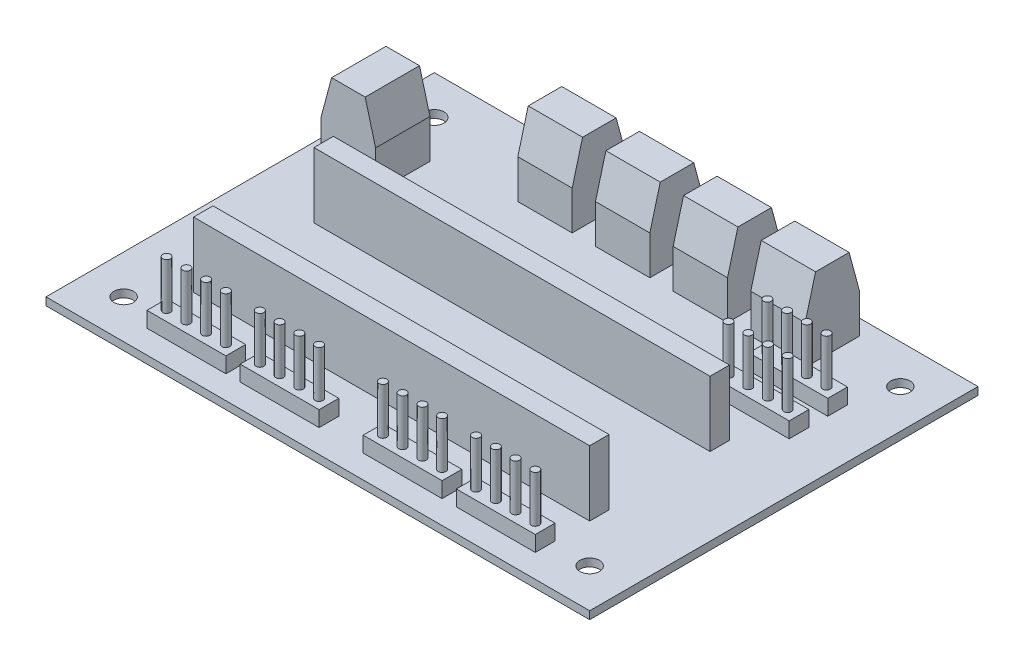
from build123d import *
from OCP.BRepFilletAPI import BRepFilletAPI_MakeChamfer

# Parameters (mm, degrees)
SKETCH_2_W      = 70
SKETCH_2_H      = 50
SKETCH_2_R      = 1.25
EXTRUDE_1_DEPTH = 1
SKETCH_3_W      = 51
SKETCH_3_H      = 2.5
EXTRUDE_2_DEPTH = 8.4
SKETCH_4_W      = 10.16
SKETCH_4_H      = 2.54
EXTRUDE_3_DEPTH = 2
SKETCH_5_R      = 0.5
EXTRUDE_4_DEPTH = 6
SKETCH_6_W      = 7
SKETCH_6_H      = 7
EXTRUDE_5_DEPTH = 10
CHAMFER_1_SIZE  = 5
CHAMFER_1_SIZE2 = 1.339745962


with BuildPart() as part:
    # Эскиз2 → Бобышка-Вытянуть1 (new body)
    with BuildSketch(Plane(origin=(0, 0, 0), x_dir=(1, 0, 0), z_dir=(0, 1, 0))):
        with Locations((35, 25)):
            Rectangle(SKETCH_2_W, SKETCH_2_H)
        with Locations((5, 45)):
            Circle(SKETCH_2_R, mode=Mode.SUBTRACT)
        with Locations((65, 45)):
            Circle(SKETCH_2_R, mode=Mode.SUBTRACT)
        with Locations((65, 5)):
            Circle(SKETCH_2_R, mode=Mode.SUBTRACT)
        with Locations((5, 5)):
            Circle(SKETCH_2_R, mode=Mode.SUBTRACT)
    extrude(amount=EXTRUDE_1_DEPTH)

    # Эскиз3 → Бобышка-Вытянуть2 (add)
    with BuildSketch(Plane(origin=(0, 1, 0), x_dir=(1, 0, 0), z_dir=(0, 1, 0))):
        with Locations((34.5, 11.25)):
            Rectangle(SKETCH_3_W, SKETCH_3_H)
        with Locations((34.5, 26.75)):
            Rectangle(SKETCH_3_W, SKETCH_3_H)
    extrude(amount=EXTRUDE_2_DEPTH)

    # Эскиз4 → Бобышка-Вытянуть3 (add)
    with BuildSketch(Plane(origin=(0, 1, 0), x_dir=(1, 0, 0), z_dir=(0, 1, 0))):
        with Locations((54.92, 4.27)):
            Rectangle(SKETCH_4_W, SKETCH_4_H)
        with Locations((42.92, 4.27)):
            Rectangle(SKETCH_4_W, SKETCH_4_H)
        with Locations((15.08, 4.27)):
            Rectangle(SKETCH_4_W, SKETCH_4_H)
        with Locations((27.08, 4.27)):
            Rectangle(SKETCH_4_W, SKETCH_4_H)
        with Locations((58.562253528, 38.283187026)):
            Rectangle(SKETCH_4_W, SKETCH_4_H)
        with Locations((58.594566993, 33.283187026)):
            Rectangle(SKETCH_4_W, SKETCH_4_H)
    extrude(amount=EXTRUDE_3_DEPTH)

    # Эскиз5 → Бобышка-Вытянуть4 (add)
    with BuildSketch(Plane(origin=(0, 3, 0), x_dir=(1, 0, 0), z_dir=(0, 1, 0))):
        with Locations((58.73, 4.27)):
            Circle(SKETCH_5_R)
        with Locations((56.19, 4.27)):
            Circle(SKETCH_5_R)
        with Locations((53.65, 4.27)):
            Circle(SKETCH_5_R)
        with Locations((51.11, 4.27)):
            Circle(SKETCH_5_R)
        with Locations((46.73, 4.27)):
            Circle(SKETCH_5_R)
        with Locations((44.19, 4.27)):
            Circle(SKETCH_5_R)
        with Locations((41.65, 4.27)):
            Circle(SKETCH_5_R)
        with Locations((39.11, 4.27)):
            Circle(SKETCH_5_R)
        with Locations((25.81, 4.27)):
            Circle(SKETCH_5_R)
        with Locations((11.27, 4.27)):
            Circle(SKETCH_5_R)
        with Locations((13.81, 4.27)):
            Circle(SKETCH_5_R)
        with Locations((16.35, 4.27)):
            Circle(SKETCH_5_R)
        with Locations((18.89, 4.27)):
            Circle(SKETCH_5_R)
        with Locations((23.27, 4.27)):
            Circle(SKETCH_5_R)
        with Locations((28.35, 4.27)):
            Circle(SKETCH_5_R)
        with Locations((30.89, 4.27)):
            Circle(SKETCH_5_R)
        with Locations((54.67096141, 33.208395661)):
            Circle(SKETCH_5_R)
        with Locations((54.67096141, 38.208395661)):
            Circle(SKETCH_5_R)
        with Locations((57.21096141, 33.208395661)):
            Circle(SKETCH_5_R)
        with Locations((59.75096141, 33.208395661)):
            Circle(SKETCH_5_R)
        with Locations((62.29096141, 33.208395661)):
            Circle(SKETCH_5_R)
        with Locations((57.21096141, 38.208395661)):
            Circle(SKETCH_5_R)
        with Locations((59.75096141, 38.208395661)):
            Circle(SKETCH_5_R)
        with Locations((62.29096141, 38.208395661)):
            Circle(SKETCH_5_R)
    extrude(amount=EXTRUDE_4_DEPTH)

    # Эскиз6 → Бобышка-Вытянуть5 (add)
    with BuildSketch(Plane(origin=(0, 1, 0), x_dir=(1, 0, 0), z_dir=(0, 1, 0))):
        with Locations((23.247184381, 44.500218353)):
            Rectangle(SKETCH_6_W, SKETCH_6_H)
        with Locations((6.108040928, 36.325560748)):
            Rectangle(SKETCH_6_W, SKETCH_6_H)
        with Locations((33.247184381, 44.500218353)):
            Rectangle(SKETCH_6_W, SKETCH_6_H)
        with Locations((43.247184381, 44.500218353)):
            Rectangle(SKETCH_6_W, SKETCH_6_H)
        with Locations((53.247184381, 44.500218353)):
            Rectangle(SKETCH_6_W, SKETCH_6_H)
    extrude(amount=EXTRUDE_5_DEPTH)

    # Фаска1: one chamfer whose edges measure the first distance from different faces: ONE call of the kernel's chamfer builder (chamfer() names one face for all edges)
    chamfer_1_edges_1 = [part.edges().sort_by_distance(p)[0] for p in [
        (53.247184381, 11, -48.000218353),
    ]]
    chamfer_1_side_1 = [part.faces().sort_by_distance(p)[0] for p in [
        (53.247184381, 6, -48.000218353),
    ]]
    chamfer_1_edges_2 = [part.edges().sort_by_distance(p)[0] for p in [
        (53.247184381, 11, -41.000218353),
    ]]
    chamfer_1_side_2 = [part.faces().sort_by_distance(p)[0] for p in [
        (53.247184381, 6, -41.000218353),
    ]]
    chamfer_1_edges_3 = [part.edges().sort_by_distance(p)[0] for p in [
        (43.247184381, 11, -48.000218353),
    ]]
    chamfer_1_side_3 = [part.faces().sort_by_distance(p)[0] for p in [
        (43.247184381, 6, -48.000218353),
    ]]
    chamfer_1_edges_4 = [part.edges().sort_by_distance(p)[0] for p in [
        (43.247184381, 11, -41.000218353),
    ]]
    chamfer_1_side_4 = [part.faces().sort_by_distance(p)[0] for p in [
        (43.247184381, 6, -41.000218353),
    ]]
    chamfer_1_edges_5 = [part.edges().sort_by_distance(p)[0] for p in [
        (33.247184381, 11, -41.000218353),
    ]]
    chamfer_1_side_5 = [part.faces().sort_by_distance(p)[0] for p in [
        (33.247184381, 6, -41.000218353),
    ]]
    chamfer_1_edges_6 = [part.edges().sort_by_distance(p)[0] for p in [
        (33.247184381, 11, -48.000218353),
    ]]
    chamfer_1_side_6 = [part.faces().sort_by_distance(p)[0] for p in [
        (33.247184381, 6, -48.000218353),
    ]]
    chamfer_1_edges_7 = [part.edges().sort_by_distance(p)[0] for p in [
        (23.247184381, 11, -48.000218353),
    ]]
    chamfer_1_side_7 = [part.faces().sort_by_distance(p)[0] for p in [
        (23.247184381, 6, -48.000218353),
    ]]
    chamfer_1_edges_8 = [part.edges().sort_by_distance(p)[0] for p in [
        (23.247184381, 11, -41.000218353),
    ]]
    chamfer_1_side_8 = [part.faces().sort_by_distance(p)[0] for p in [
        (23.247184381, 6, -41.000218353),
    ]]
    chamfer_1_edges_9 = [part.edges().sort_by_distance(p)[0] for p in [
        (9.608040928, 11, -36.325560748),
    ]]
    chamfer_1_side_9 = [part.faces().sort_by_distance(p)[0] for p in [
        (9.608040928, 6, -36.325560748),
    ]]
    chamfer_1_edges_10 = [part.edges().sort_by_distance(p)[0] for p in [
        (2.608040928, 11, -36.325560748),
    ]]
    chamfer_1_side_10 = [part.faces().sort_by_distance(p)[0] for p in [
        (2.608040928, 6, -36.325560748),
    ]]
    chamfer_1 = BRepFilletAPI_MakeChamfer(part.part.solid().wrapped)
    for e in chamfer_1_edges_1:
        chamfer_1.Add(CHAMFER_1_SIZE, CHAMFER_1_SIZE2, e.wrapped, chamfer_1_side_1[0].wrapped)  # the first distance lies on this face
    for e in chamfer_1_edges_2:
        chamfer_1.Add(CHAMFER_1_SIZE, CHAMFER_1_SIZE2, e.wrapped, chamfer_1_side_2[0].wrapped)  # the first distance lies on this face
    for e in chamfer_1_edges_3:
        chamfer_1.Add(CHAMFER_1_SIZE, CHAMFER_1_SIZE2, e.wrapped, chamfer_1_side_3[0].wrapped)  # the first distance lies on this face
    for e in chamfer_1_edges_4:
        chamfer_1.Add(CHAMFER_1_SIZE, CHAMFER_1_SIZE2, e.wrapped, chamfer_1_side_4[0].wrapped)  # the first distance lies on this face
    for e in chamfer_1_edges_5:
        chamfer_1.Add(CHAMFER_1_SIZE, CHAMFER_1_SIZE2, e.wrapped, chamfer_1_side_5[0].wrapped)  # the first distance lies on this face
    for e in chamfer_1_edges_6:
        chamfer_1.Add(CHAMFER_1_SIZE, CHAMFER_1_SIZE2, e.wrapped, chamfer_1_side_6[0].wrapped)  # the first distance lies on this face
    for e in chamfer_1_edges_7:
        chamfer_1.Add(CHAMFER_1_SIZE, CHAMFER_1_SIZE2, e.wrapped, chamfer_1_side_7[0].wrapped)  # the first distance lies on this face
    for e in chamfer_1_edges_8:
        chamfer_1.Add(CHAMFER_1_SIZE, CHAMFER_1_SIZE2, e.wrapped, chamfer_1_side_8[0].wrapped)  # the first distance lies on this face
    for e in chamfer_1_edges_9:
        chamfer_1.Add(CHAMFER_1_SIZE, CHAMFER_1_SIZE2, e.wrapped, chamfer_1_side_9[0].wrapped)  # the first distance lies on this face
    for e in chamfer_1_edges_10:
        chamfer_1.Add(CHAMFER_1_SIZE, CHAMFER_1_SIZE2, e.wrapped, chamfer_1_side_10[0].wrapped)  # the first distance lies on this face
    add(Compound.cast(chamfer_1.Shape()), mode=Mode.REPLACE)


solid = part.part
